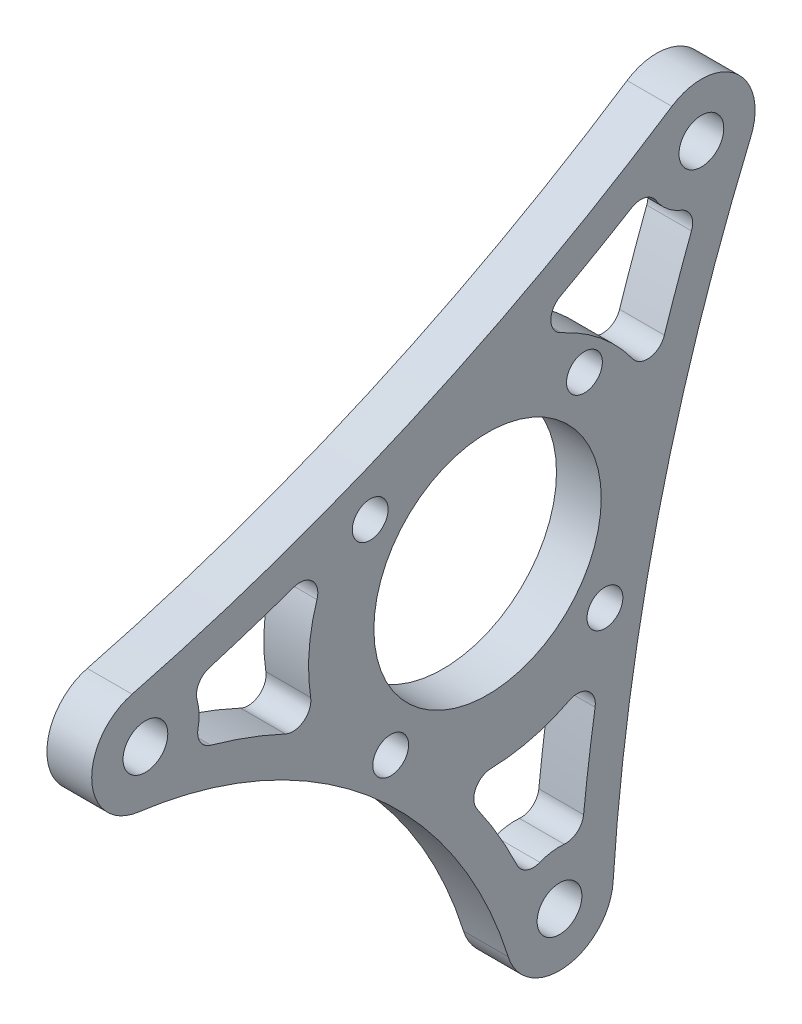
from build123d import *

# Parameters (mm, degrees)
SZKIC1_R                    = 2.50008225
SZKIC1_R_2                  = 12.7
SZKIC1_R_3                  = 2
DODANIE_WYCI_GNI_CIE1_DEPTH = 5


with BuildPart() as part:
    # Szkic1 → Dodanie-wyciągnięcie1 (new body)
    with BuildSketch(Plane(origin=(0, 0, 0), x_dir=(0, 0, -1), z_dir=(1, 0, 0))):
        with BuildLine():
            ThreePointArc((2.309377373, -39.185033633), (-13.26971556, -15.814231192), (-38.990744097, -4.530116941))
            ThreePointArc((-38.990744097, -4.530116941), (-44.209247815, 1.052274662), (-39.713425518, 7.231551232))
            ThreePointArc((-39.713425518, 7.231551232), (-8.456598713, 18.08716435), (20.582653249, 33.947662563))
            ThreePointArc((20.582653249, 33.947662563), (27.724225606, 33.548248849), (29.408837235, 26.596725944))
            ThreePointArc((29.408837235, 26.596725944), (19.031730806, -4.961655134), (14.021628415, -37.802401596))
            ThreePointArc((14.021628415, -37.802401596), (8.739010213, -43.351887764), (2.309377373, -39.185033633))
        make_face()
        with Locations((-38.220541863, 1.420243428)):
            Circle(SZKIC1_R, mode=Mode.SUBTRACT)
        with Locations((8.035594183, -37.393263268)):
            Circle(SZKIC1_R, mode=Mode.SUBTRACT)
        Circle(SZKIC1_R_2, mode=Mode.SUBTRACT)
        with Locations((23.884419268, 28.937838099)):
            Circle(SZKIC1_R, mode=Mode.SUBTRACT)
        with Locations((13.11097221, -10.821386589)):
            Circle(SZKIC1_R_3, mode=Mode.SUBTRACT)
        with Locations((10.821386589, 13.11097221)):
            Circle(SZKIC1_R_3, mode=Mode.SUBTRACT)
        with Locations((-13.11097221, 10.821386589)):
            Circle(SZKIC1_R_3, mode=Mode.SUBTRACT)
        with Locations((-10.821386589, -13.11097221)):
            Circle(SZKIC1_R_3, mode=Mode.SUBTRACT)
        with BuildLine():
            ThreePointArc((8.114292735, 21.799150364), (12.12569299, 24.043387147), (16.085511208, 26.377433081))
            ThreePointArc((16.085511208, 26.377433081), (17.57990808, 26.612522159), (18.811427379, 25.73397273))
            ThreePointArc((18.811427379, 25.73397273), (20.04461293, 24.327427348), (21.651018751, 23.3690032))
            ThreePointArc((21.651018751, 23.3690032), (22.737836681, 22.316712521), (22.776935902, 20.804442659))
            ThreePointArc((22.776935902, 20.804442659), (21.215271139, 16.537624591), (19.749021282, 12.237084554))
            ThreePointArc((19.749021282, 12.237084554), (18.154695697, 10.884881068), (16.226319868, 11.692157352))
            ThreePointArc((16.226319868, 11.692157352), (12.664298548, 15.479520093), (8.246420372, 18.220772515))
            ThreePointArc((8.246420372, 18.220772515), (7.072424391, 19.969052272), (8.114292735, 21.799150364))
        make_face(mode=Mode.SUBTRACT)
        with BuildLine():
            ThreePointArc((12.011058029, -19.887296573), (11.309027353, -24.754760532), (10.724532147, -29.637732763))
            ThreePointArc((10.724532147, -29.637732763), (10.006016571, -30.968981895), (8.560889048, -31.416302058))
            ThreePointArc((8.560889048, -31.416302058), (7.177299033, -31.454969789), (5.839385019, -31.809656431))
            ThreePointArc((5.839385019, -31.809656431), (4.374939886, -31.809536164), (3.30315775, -30.81159698))
            ThreePointArc((3.30315775, -30.81159698), (1.221721407, -26.88472803), (-1.175587183, -23.14232392))
            ThreePointArc((-1.175587183, -23.14232392), (-1.32095465, -21.090364098), (0.420628112, -19.995576311))
            ThreePointArc((0.420628112, -19.995576311), (4.896594546, -19.391321818), (9.122842015, -17.798139048))
            ThreePointArc((9.122842015, -17.798139048), (11.207295723, -17.957453446), (12.011058029, -19.887296573))
        make_face(mode=Mode.SUBTRACT)
        with BuildLine():
            ThreePointArc((-32.340394841, 0.226982768), (-32.085978173, -1.215193269), (-30.917086913, -2.097402305))
            ThreePointArc((-30.917086913, -2.097402305), (-26.688438298, -3.465323315), (-22.586601448, -5.176349748))
            ThreePointArc((-22.586601448, -5.176349748), (-20.54057271, -4.963189672), (-19.764839882, -3.057957562))
            ThreePointArc((-19.764839882, -3.057957562), (-19.940396179, 1.542919389), (-19.059166876, 6.062025899))
            ThreePointArc((-19.059166876, 6.062025899), (-19.573024527, 8.104254826), (-21.63024017, 8.554379779))
            ThreePointArc((-21.63024017, 8.554379779), (-26.338724273, 6.958158991), (-31.084708767, 5.477154421))
            ThreePointArc((-31.084708767, 5.477154421), (-32.262771319, 4.528124649), (-32.439317737, 3.025686548))
            ThreePointArc((-32.439317737, 3.025686548), (-32.224286367, 1.632186887), (-32.340394841, 0.226982768))
        make_face(mode=Mode.SUBTRACT)
    extrude(amount=DODANIE_WYCI_GNI_CIE1_DEPTH)


solid = part.part
